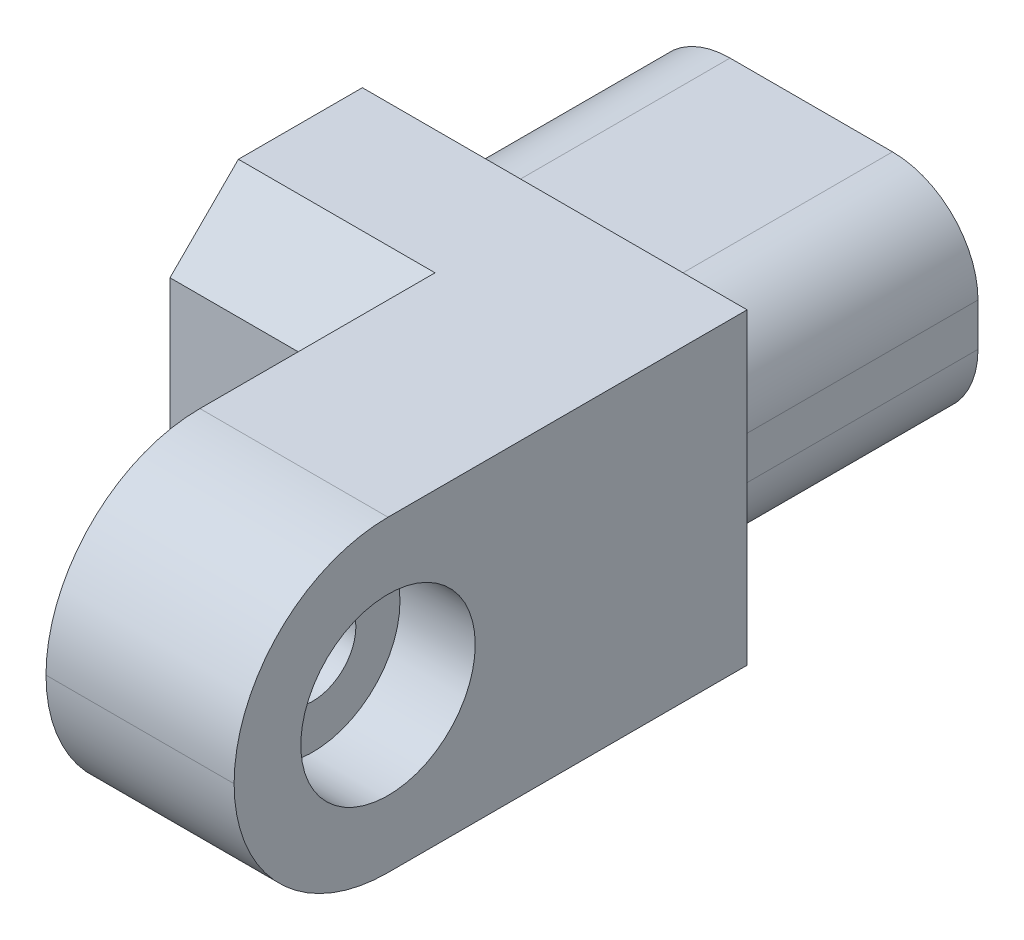
from build123d import *

# Parameters (mm, degrees)
SKETCH2_W                                            = 24.765
SKETCH2_H                                            = 15.875
BOSS_EXTRUDE1_DEPTH                                  = 19.05
SKETCH3_W                                            = 28.575
SKETCH3_H                                            = 22.86
BOSS_EXTRUDE2_DEPTH                                  = 38.1
SKETCH4_W                                            = 14.605
SKETCH4_H                                            = 23.8125
CUT_EXTRUDE1_DEPTH                                   = 47.6725
FILLET5_R                                            = 11.43
FILLET3_R                                            = 6.35
CHAMFER1_SIZE                                        = 5.08
CBORE_FOR_1_4_FILLISTER_HEAD_MACHINE_SCR_D           = 6.4008
CBORE_FOR_1_4_FILLISTER_HEAD_MACHINE_SCR_CBORE_D     = 12.954
CBORE_FOR_1_4_FILLISTER_HEAD_MACHINE_SCR_CBORE_DEPTH = 5.588


with BuildPart() as part:
    # Sketch2 → Boss-Extrude1 (new body)
    with BuildSketch(Plane.XY):
        Rectangle(SKETCH2_W, SKETCH2_H)
    extrude(amount=-BOSS_EXTRUDE1_DEPTH)

    # Sketch3 → Boss-Extrude2 (add)
    with BuildSketch(Plane.XY):
        Rectangle(SKETCH3_W, SKETCH3_H)
    extrude(amount=BOSS_EXTRUDE2_DEPTH)

    # Sketch4 → Cut-Extrude1 (cut, through all)
    with BuildSketch(Plane(origin=(0, -11.43, 0), x_dir=(-1, 0, 0), z_dir=(0, -1, 0))):
        with Locations((6.985, -26.19375)):
            Rectangle(SKETCH4_W, SKETCH4_H)
    extrude(amount=-CUT_EXTRUDE1_DEPTH, mode=Mode.SUBTRACT)

    # Fillet5
    fillet5_edges = [part.edges().sort_by_distance(p)[0] for p in [
        (7.3025, -11.43, 38.1),
        (7.3025, 11.43, 38.1),
    ]]
    fillet(fillet5_edges, radius=FILLET5_R - 0.0001)  # a hair under: the kernel refuses the full size

    # Fillet3
    fillet3_edges = [part.edges().sort_by_distance(p)[0] for p in [
        (-12.3825, 7.9375, -9.525),
        (12.3825, 7.9375, -9.525),
        (12.3825, -7.9375, -9.525),
        (-12.3825, -7.9375, -9.525),
    ]]
    fillet(fillet3_edges, radius=FILLET3_R)

    # Chamfer1
    chamfer1_edges = [part.edges().sort_by_distance(p)[0] for p in [
        (-6.985, 11.43, 14.2875),
        (-6.985, -11.43, 14.2875),
    ]]
    chamfer(chamfer1_edges, length=CHAMFER1_SIZE)

    # CBORE for 1/4 Fillister Head Machine Screw1 (through all)
    with Locations(Plane(origin=(14.2875, 0, 26.67), x_dir=(0, 0, 1), z_dir=(1, 0, 0))):
        with Locations((0, 0)):
            cbore_for_1_4_fillister_head_machine_scr = CounterBoreHole(CBORE_FOR_1_4_FILLISTER_HEAD_MACHINE_SCR_D / 2, CBORE_FOR_1_4_FILLISTER_HEAD_MACHINE_SCR_CBORE_D / 2, CBORE_FOR_1_4_FILLISTER_HEAD_MACHINE_SCR_CBORE_DEPTH)

    # Mirror1: CBORE for 1/4 Fillister Head Machine Screw1 across plane
    add(cbore_for_1_4_fillister_head_machine_scr.mirror(Plane(origin=(6.985, 0, 0), x_dir=(0, 0, 1), z_dir=(1, 0, 0))), mode=Mode.SUBTRACT)


solid = part.part
